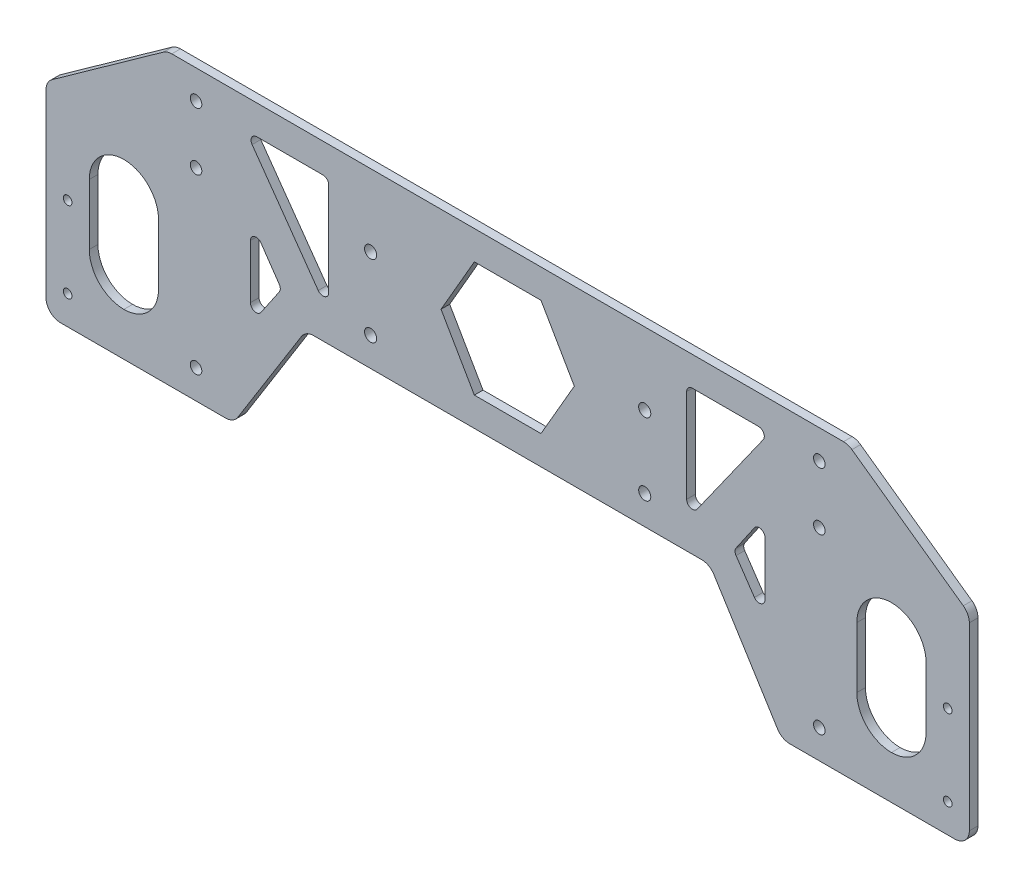
from build123d import *

# Parameters (mm, degrees)
SKETCH_1_W                  = 320
SKETCH_1_H                  = 100
EXTRUDE_1_DEPTH             = 3
HOLE_WIZARD_4_0_4_1_D       = 4
HOLE_WIZARD_4_2_4_2_1_D     = 4.2
PATTERN_LINEAR_1_COUNT      = 2
PATTERN_LINEAR_1_PITCH      = 95
PATTERN_LINEAR_1_COUNT_DIR2 = 2
PATTERN_LINEAR_1_PITCH_DIR2 = 25
CUT_EXTRUDE_1_DEPTH         = 3
SKETCH_8_W                  = 24
SKETCH_8_H                  = 45
CUT_EXTRUDE_6_DEPTH         = 3
PATTERN_LINEAR_2_COUNT      = 2
PATTERN_LINEAR_2_PITCH      = 60
PATTERN_LINEAR_2_COPY_1_D   = 4
HOLE_WIZARD_3_0_3_1_D       = 3
CUT_EXTRUDE_8_DEPTH         = 3
FILLET_1_R                  = 12
PATTERN_LINEAR_3_COUNT      = 2
PATTERN_LINEAR_3_PITCH      = 80
PATTERN_LINEAR_3_COPY_1_D   = 4
FILLET_2_R                  = 5
CUT_EXTRUDE_9_DEPTH         = 3
FILLET_3_R                  = 2
CUT_EXTRUDE_10_DEPTH        = 10


with BuildPart() as part:
    # 草图1 → 凸台-拉伸1 (new body)
    with BuildSketch(Plane.XY):
        Rectangle(SKETCH_1_W, SKETCH_1_H)
    extrude(amount=EXTRUDE_1_DEPTH)

    # Ø4.0 (4) 直径孔1 (through all)
    with Locations(Plane(origin=(0, 0, 0), x_dir=(-1, 0, 0), z_dir=(0, 0, -1))):
        with Locations((108, -40)):
            hole_wizard_4_0_4_1 = Hole(HOLE_WIZARD_4_0_4_1_D / 2)

    # 镜向1: Ø4.0 (4) 直径孔1 across plane
    add(hole_wizard_4_0_4_1.mirror(Plane(origin=(0, 0, 0), x_dir=(0, 0, 1), z_dir=(1, 0, 0))), mode=Mode.SUBTRACT)

    # Ø4.2 (4.2) 直径孔1 (through all)
    with Locations(Plane(origin=(0, 0, 0), x_dir=(-1, 0, 0), z_dir=(0, 0, -1))):
        with Locations((47.5, 0)):
            hole_wizard_4_2_4_2_1 = Hole(HOLE_WIZARD_4_2_4_2_1_D / 2)

    # 阵列(线性)1: Hole Wizard 4.2 _4.2_ _1 2 × 2
    with Locations(*[(i * PATTERN_LINEAR_1_PITCH, j * PATTERN_LINEAR_1_PITCH_DIR2, 0) for i in range(PATTERN_LINEAR_1_COUNT) for j in range(PATTERN_LINEAR_1_COUNT_DIR2) if (i, j) != (0, 0)]):
        add(hole_wizard_4_2_4_2_1, mode=Mode.SUBTRACT)

    # 草图6 → 切除-拉伸1 (cut)
    with BuildSketch(Plane(origin=(0, 0, 0), x_dir=(-1, 0, 0), z_dir=(0, 0, -1))):
        Polygon((0, -50), (0, -10), (70, -10), (95, -50), align=None)
    cut_extrude_1 = extrude(amount=-CUT_EXTRUDE_1_DEPTH, mode=Mode.SUBTRACT)

    # 镜向2: 切除-拉伸1 across plane
    add(cut_extrude_1.mirror(Plane(origin=(0, -50, 3), x_dir=(0, 0, 1), z_dir=(1, 0, 0))), mode=Mode.SUBTRACT)

    # 草图8 → 切除-拉伸6 (cut)
    with BuildSketch(Plane(origin=(0, 0, 0), x_dir=(-1, 0, 0), z_dir=(0, 0, -1))):
        with Locations((-133, -12.5)):
            Rectangle(SKETCH_8_W, SKETCH_8_H)
    cut_extrude_6 = extrude(amount=-CUT_EXTRUDE_6_DEPTH, mode=Mode.SUBTRACT)

    # 镜向4: 切除-拉伸6 across plane
    add(cut_extrude_6.mirror(Plane(origin=(0, 0, 0), x_dir=(0, 0, 1), z_dir=(1, 0, 0))), mode=Mode.SUBTRACT)

    # 阵列(线性)2: Ø4.0 (4) 直径孔1 ×2
    with Locations(*[(0, i * PATTERN_LINEAR_2_PITCH, 0) for i in range(1, PATTERN_LINEAR_2_COUNT)]):
        add(hole_wizard_4_0_4_1, mode=Mode.SUBTRACT)

    # 阵列(线性)2 copy 1 (through all)
    with Locations(Plane(origin=(0, 60, 0), x_dir=(1, 0, 0), z_dir=(0, 0, -1))):
        with Locations((108, 40)):
            Hole(PATTERN_LINEAR_2_COPY_1_D / 2)

    # Ø3.0 (3) 直径孔1 (through all)
    with Locations(Plane.XY.offset(3)):
        with Locations((-152.5, -40), (-152.5, -12)):
            hole_wizard_3_0_3_1 = Hole(HOLE_WIZARD_3_0_3_1_D / 2)

    # 草图11 → 切除-拉伸8 (cut)
    with BuildSketch(Plane.XY.offset(3)):
        Polygon((-118, 50), (-160, 50), (-160, 20), align=None)
    cut_extrude_8 = extrude(amount=-CUT_EXTRUDE_8_DEPTH, mode=Mode.SUBTRACT)

    # 镜向6: 切除-拉伸8 across plane
    add(cut_extrude_8.mirror(Plane(origin=(0, 0, 0), x_dir=(0, 0, 1), z_dir=(1, 0, 0))), mode=Mode.SUBTRACT)

    # 镜向7: Ø3.0 (3) 直径孔1 across plane
    add(hole_wizard_3_0_3_1.mirror(Plane(origin=(0, 0, 0), x_dir=(0, 0, 1), z_dir=(1, 0, 0))), mode=Mode.SUBTRACT)

    # 圆角1
    fillet_1_edges = [part.edges().sort_by_distance(p)[0] for p in [
        (145, -35, 1.5),
        (121, -35, 1.5),
        (145, 10, 1.5),
        (121, 10, 1.5),
        (-145, -35, 1.5),
        (-121, -35, 1.5),
        (-145, 10, 1.5),
        (-121, 10, 1.5),
    ]]
    fillet(fillet_1_edges, radius=FILLET_1_R - 0.0001)  # a hair under: the kernel refuses the full size

    # 阵列(线性)3: Ø4.0 (4) 直径孔1 ×2
    with Locations(*[(0, i * PATTERN_LINEAR_3_PITCH, 0) for i in range(1, PATTERN_LINEAR_3_COUNT)]):
        add(hole_wizard_4_0_4_1, mode=Mode.SUBTRACT)

    # 阵列(线性)3 copy 1 (through all)
    with Locations(Plane(origin=(0, 80, 0), x_dir=(1, 0, 0), z_dir=(0, 0, -1))):
        with Locations((108, 40)):
            Hole(PATTERN_LINEAR_3_COPY_1_D / 2)

    # 圆角2
    fillet_2_edges = [part.edges().sort_by_distance(p)[0] for p in [
        (-160, 20, 1.5),
        (-118, 50, 1.5),
        (160, 20, 1.5),
        (118, 50, 1.5),
        (-95, -50, 1.5),
        (-70, -10, 1.5),
        (95, -50, 1.5),
        (70, -10, 1.5),
        (160, -50, 1.5),
        (-160, -50, 1.5),
    ]]
    fillet(fillet_2_edges, radius=FILLET_2_R)

    # 草图12 → 切除-拉伸9 (cut)
    with BuildSketch(Plane(origin=(0, 0, 0), x_dir=(-1, 0, 0), z_dir=(0, 0, -1))):
        Polygon((-89.16731107, -17.567353927), (-78.38158698, -1.676376149), (-89.16731107, 14.034356584), align=None)
        Polygon((-90.804111964, 39.84100352), (-62.022726086, 39.84100352), (-62.022726086, -0.778396903), align=None)
    cut_extrude_9 = extrude(amount=-CUT_EXTRUDE_9_DEPTH, mode=Mode.SUBTRACT)

    # 镜向8: 切除-拉伸9 across plane
    add(cut_extrude_9.mirror(Plane(origin=(0, 0, 0), x_dir=(0, 0, 1), z_dir=(1, 0, 0))), mode=Mode.SUBTRACT)

    # 圆角3
    fillet_3_edges = [part.edges().sort_by_distance(p)[0] for p in [
        (89.16731107, -17.567353927, 1.5),
        (89.16731107, 14.034356584, 1.5),
        (78.38158698, -1.676376149, 1.5),
        (62.022726086, -0.778396903, 1.5),
        (90.804111964, 39.84100352, 1.5),
        (62.022726086, 39.84100352, 1.5),
        (-89.16731107, 14.034356584, 1.5),
        (-89.16731107, -17.567353927, 1.5),
        (-78.38158698, -1.676376149, 1.5),
        (-90.804111964, 39.84100352, 1.5),
        (-62.022726086, -0.778396903, 1.5),
        (-62.022726086, 39.84100352, 1.5),
    ]]
    fillet(fillet_3_edges, radius=FILLET_3_R)

    # 草图13 → 切除-拉伸10 (cut)
    with BuildSketch(Plane.XY.offset(3)):
        Polygon((-23.094010768, 20), (-11.547005384, 0), (11.547005384, 0), (23.094010768, 20), (11.547005384, 40), (-11.547005384, 40), align=None)
    extrude(amount=-CUT_EXTRUDE_10_DEPTH, mode=Mode.SUBTRACT)


solid = part.part
